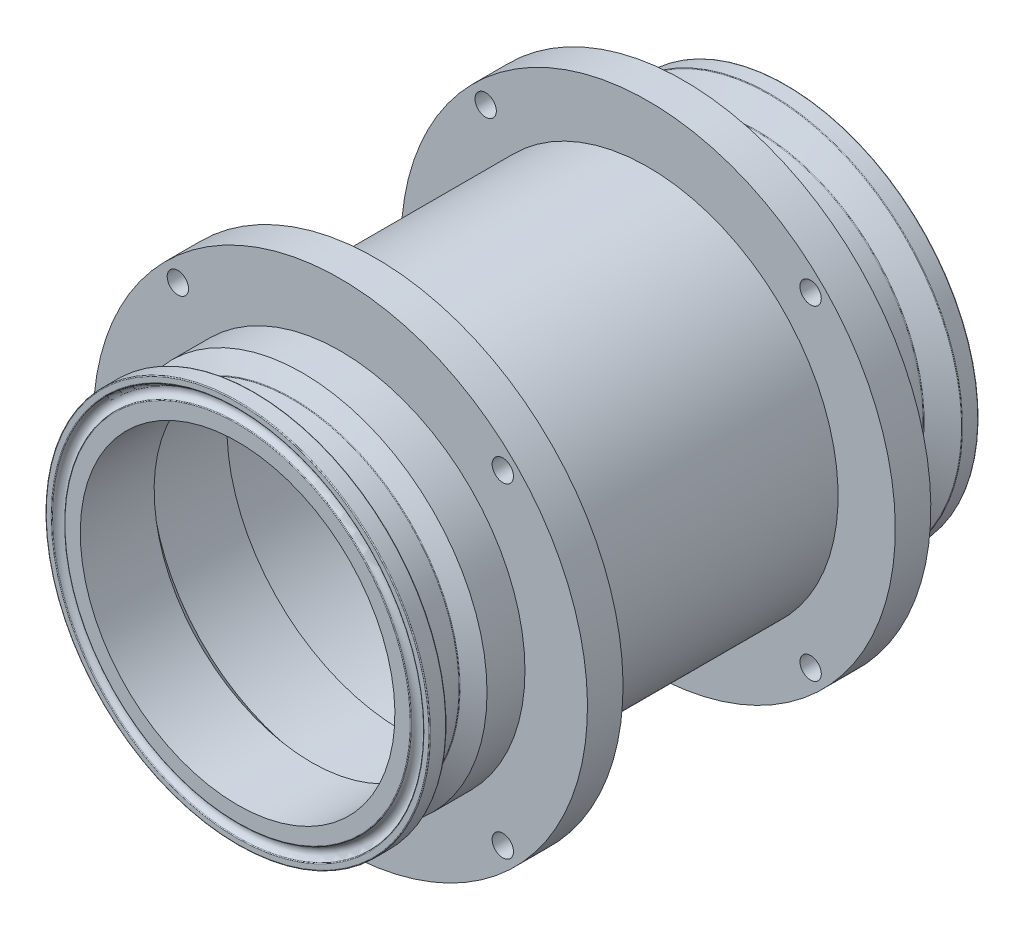
from build123d import *

# Parameters (mm, degrees)
FILLET1_R           = 0.254
SKETCH3_R           = 58.8
SKETCH3_R_2         = 57.15
BOSS_EXTRUDE1_DEPTH = 84.27
SKETCH4_R           = 3.302
CUT_EXTRUDE1_DEPTH  = 176.40759655
CIRPATTERN1_COUNT   = 4


# Read off the part's stored shape, not the designer's step: Revolve1
with BuildPart() as part:
    # Revolve1 outline → Revolve1 (revolve)
    with BuildSketch(Plane.XZ):
        with BuildLine():
            Line((57.15, -5.34308624), (57.15, 6.4))
            Line((57.15, 6.4), (76.5, 6.4))
            Line((76.5, 6.4), (76.5, 17.4))
            Line((76.5, 17.4), (57.15, 17.4))
            Line((57.15, 17.4), (57.15, 25.4))
            Line((57.15, 25.4), (54.102, 25.4))
            Line((54.102, 25.4), (54.102, 1.999696825))
            Line((54.102, 1.999696825), (48.6918, -2.54))
            Line((48.6918, -2.54), (48.6918, -25.4))
            Line((48.6918, -25.4), (53.63603628, -25.4))
            ThreePointArc((53.63603628, -25.4), (55.566733333, -23.706666667), (57.497430386, -25.4))
            Line((57.497430386, -25.4), (59.4614, -25.4))
            Line((59.4614, -25.4), (59.4614, -20.32))
            Line((59.4614, -20.32), (51.7398, -16.086666667))
            Line((51.7398, -16.086666667), (51.7398, -8.466666667))
            Line((51.7398, -8.466666667), (57.15, -5.34308624))
        make_face()
    revolve(axis=Axis((0, 0, 0), (0, 0, 1)))

    # Fillet1
    fillet1_edges = [part.edges().sort_by_distance(p)[0] for p in [
        (-51.7398, 0, -8.466666667),
        (-51.7398, 0, -16.086666667),
        (-59.4614, 0, -20.32),
        (-59.4614, 0, -25.4),
        (-57.497430386, 0, -25.4),
        (-53.63603628, 0, -25.4),
    ]]
    fillet(fillet1_edges, radius=FILLET1_R)


with BuildPart() as body_2:
    # Sketch3 → Boss-Extrude1 (new body)
    with BuildSketch(Plane(origin=(0, 0, 17.4), x_dir=(-1, 0, 0), z_dir=(0, 0, -1))):
        Circle(SKETCH3_R)
        Circle(SKETCH3_R_2, mode=Mode.SUBTRACT)
    extrude(amount=-BOSS_EXTRUDE1_DEPTH)


with BuildPart() as body_3:
    # Mirror1: mirrored copy
    add(part.part.mirror(Plane.XY.offset(59.535)))


with BuildPart() as cut_extrude1_tool:
    # Sketch4 → Cut-Extrude1 (new, through all)
    with BuildSketch(Plane.XY.offset(112.67)):
        with Locations((50.289434278, 50.289434278)):
            Circle(SKETCH4_R)
    cut_extrude1 = extrude(amount=-CUT_EXTRUDE1_DEPTH)


with BuildPart() as part_1:
    add(part.part)

    # Cut-Extrude1: cut by cut_extrude1_tool
    add(cut_extrude1_tool.part, mode=Mode.SUBTRACT)


with BuildPart() as body_3_1:
    add(body_3.part)

    # Cut-Extrude1: cut by cut_extrude1_tool
    add(cut_extrude1_tool.part, mode=Mode.SUBTRACT)


with BuildPart() as cirpattern1_tool:
    # CirPattern1: Cut-Extrude1 ×4 about axis
    cirpattern1_axis = Axis((0, 0, 0), (0, 0, 1))
    for i in range(1, CIRPATTERN1_COUNT):
        add(cut_extrude1.rotate(cirpattern1_axis, i * 360 / CIRPATTERN1_COUNT))


with BuildPart() as part_2:
    add(part_1.part)

    # CirPattern1: cut by cirpattern1_tool
    add(cirpattern1_tool.part, mode=Mode.SUBTRACT)


with BuildPart() as body_3_2:
    add(body_3_1.part)

    # CirPattern1: cut by cirpattern1_tool
    add(cirpattern1_tool.part, mode=Mode.SUBTRACT)


solid = Compound([body_2.part, part_2.part, body_3_2.part])
